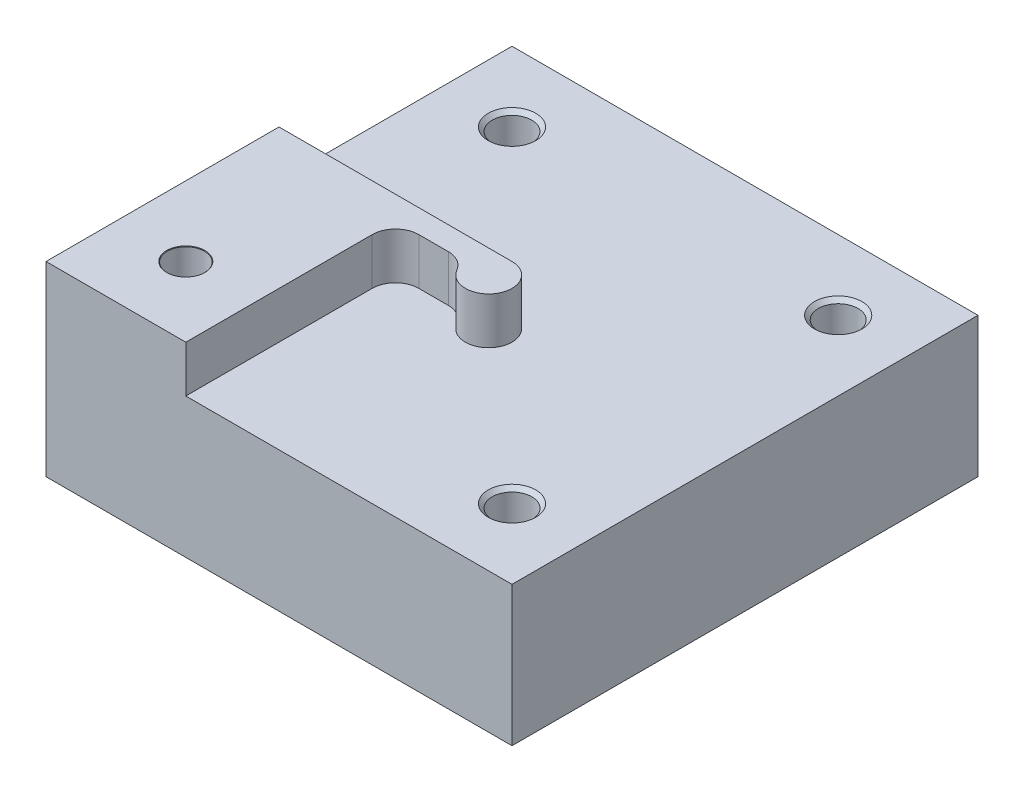
from build123d import *

# Parameters (mm, degrees)
SKETCH2_W           = 100
SKETCH2_H           = 100
BOSS_EXTRUDE1_DEPTH = 30
BOSS_EXTRUDE2_DEPTH = 10
SKETCH5_R           = 4.25
CUT_EXTRUDE1_DEPTH  = 15
CHAMFER1_SIZE       = 0.85
SKETCH7_R           = 4
CUT_EXTRUDE2_DEPTH  = 15
CHAMFER2_SIZE       = 0.1


with BuildPart() as part:
    # Sketch2 → Boss-Extrude1 (new body)
    with BuildSketch(Plane(origin=(0, 0, 0), x_dir=(1, 0, 0), z_dir=(0, 1, 0))):
        Rectangle(SKETCH2_W, SKETCH2_H)
    extrude(amount=BOSS_EXTRUDE1_DEPTH)

    # Sketch4 → Boss-Extrude2 (add)
    with BuildSketch(Plane(origin=(0, 30, 0), x_dir=(1, 0, 0), z_dir=(0, 1, 0))):
        with BuildLine():
            Line((-50, -50), (-50, 0))
            Line((-50, 0), (0, 0))
            ThreePointArc((0, 0), (4.330127019, -7.5), (-4.330127019, -7.5))
            ThreePointArc((-4.330127019, -7.5), (-6.160254038, -5.669872981), (-8.660254038, -5))
            Line((-8.660254038, -5), (-15, -5))
            ThreePointArc((-15, -5), (-18.535533906, -6.464466094), (-20, -10))
            Line((-20, -10), (-20, -50))
            Line((-20, -50), (-50, -50))
        make_face()
    extrude(amount=BOSS_EXTRUDE2_DEPTH)

    # Sketch5 → Cut-Extrude1 (cut)
    with BuildSketch(Plane(origin=(0, 30, 0), x_dir=(1, 0, 0), z_dir=(0, 1, 0))):
        with Locations((35, 35)):
            Circle(SKETCH5_R)
        with Locations((-35, 35)):
            Circle(SKETCH5_R)
        with Locations((35, -35)):
            Circle(SKETCH5_R)
    extrude(amount=-CUT_EXTRUDE1_DEPTH, mode=Mode.SUBTRACT)

    # Chamfer1
    chamfer1_edges = [part.edges().sort_by_distance(p)[0] for p in [
        (30.75, 30, 35),
        (30.75, 30, -35),
        (-39.25, 30, -35),
    ]]
    chamfer(chamfer1_edges, length=CHAMFER1_SIZE)

    # Sketch7 → Cut-Extrude2 (cut)
    with BuildSketch(Plane(origin=(0, 40, 0), x_dir=(1, 0, 0), z_dir=(0, 1, 0))):
        with Locations((-35, -35)):
            Circle(SKETCH7_R)
    extrude(amount=-CUT_EXTRUDE2_DEPTH, mode=Mode.SUBTRACT)

    # Chamfer2
    chamfer2_edges = [part.edges().sort_by_distance(p)[0] for p in [
        (-39, 40, 35),
    ]]
    chamfer(chamfer2_edges, length=CHAMFER2_SIZE)


solid = part.part
